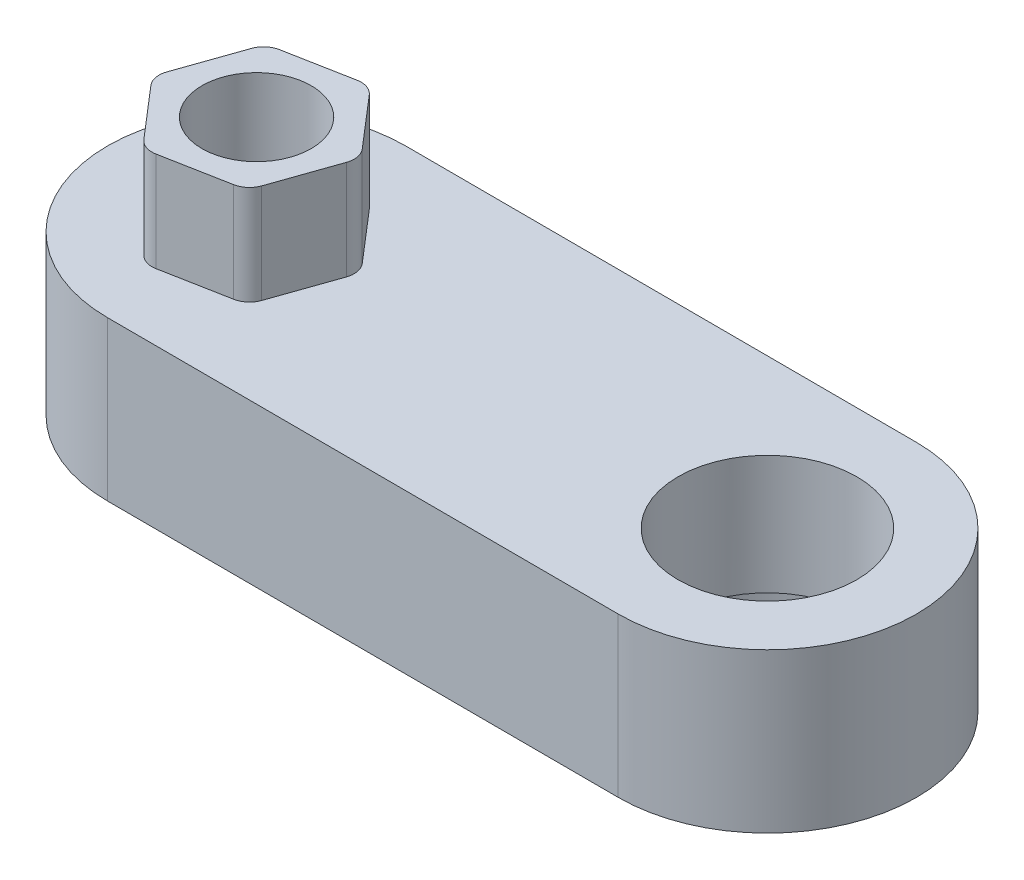
from build123d import *

# Parameters (mm, degrees)
BOSS_EXTRUDE1_DEPTH = 8
BOSS_EXTRUDE2_DEPTH = 5
SKETCH3_R           = 2.75
CUT_EXTRUDE1_DEPTH  = 47.101580863
FILLET1_R           = 1
CUT_EXTRUDE2_DEPTH  = 3
SKETCH5_R           = 6.6
CUT_EXTRUDE3_DEPTH  = 2
SKETCH6_R           = 4.5
CUT_EXTRUDE4_DEPTH  = 46.578018365


with BuildPart() as part:
    # Sketch1 → Boss-Extrude1 (new body)
    with BuildSketch(Plane(origin=(0, 0, 0), x_dir=(1, 0, 0), z_dir=(0, 1, 0))):
        with BuildLine():
            Line((28.167708625, -26.130388935), (2.369745396, -26.064259321))
            ThreePointArc((2.369745396, -26.064259321), (-5.111004784, -18.545058782), (2.408195755, -11.064308602))
            Line((2.408195755, -11.064308602), (28.206158985, -11.130438216))
            ThreePointArc((28.206158985, -11.130438216), (35.686909165, -18.649638756), (28.167708625, -26.130388935))
        make_face()
    extrude(amount=BOSS_EXTRUDE1_DEPTH)

    # Sketch2 → Boss-Extrude2 (add)
    with BuildSketch(Plane(origin=(0, 8, 0), x_dir=(1, 0, 0), z_dir=(0, 1, 0))):
        Polygon((0.900323586, -22.81445221), (5.325400754, -21.978574196), (6.814047744, -17.728405947), (3.877617565, -14.314115713), (-0.547459604, -15.149993727), (-2.036106593, -19.400161976), align=None)
    extrude(amount=BOSS_EXTRUDE2_DEPTH)

    # Sketch3 → Cut-Extrude1 (cut, through all)
    with BuildSketch(Plane(origin=(0, 13, 0), x_dir=(1, 0, 0), z_dir=(0, 1, 0))):
        with Locations((2.388970575, -18.564283961)):
            Circle(SKETCH3_R)
    extrude(amount=-CUT_EXTRUDE1_DEPTH, mode=Mode.SUBTRACT)

    # Fillet1
    fillet1_edges = [part.edges().sort_by_distance(p)[0] for p in [
        (-0.547459604, 10.5, 15.149993727),
        (3.877617565, 10.5, 14.314115713),
        (6.814047744, 10.5, 17.728405947),
        (-2.036106593, 10.5, 19.400161976),
        (0.900323586, 10.5, 22.81445221),
        (5.325400754, 10.5, 21.978574196),
    ]]
    fillet(fillet1_edges, radius=FILLET1_R)

    # Sketch4 → Cut-Extrude2 (cut)
    with BuildSketch(Plane.XZ):
        with BuildLine():
            Line((7.095087062, 18.438582147), (5.988144429, 21.598963665))
            ThreePointArc((5.988144429, 21.598963665), (5.550555759, 22.240369807), (4.850889783, 22.577049485))
            Line((4.850889783, 22.577049485), (1.560447786, 23.198599803))
            ThreePointArc((1.560447786, 23.198599803), (0.786179438, 23.140339969), (0.144773296, 22.702751299))
            Line((0.144773296, 22.702751299), (-2.038726067, 20.163920099))
            ThreePointArc((-2.038726067, 20.163920099), (-2.375405745, 19.464254124), (-2.317145911, 18.689985776))
            Line((-2.317145911, 18.689985776), (-1.210203278, 15.529604258))
            ThreePointArc((-1.210203278, 15.529604258), (-0.772614608, 14.888198116), (-0.072948633, 14.551518438))
            Line((-0.072948633, 14.551518438), (3.217493364, 13.92996812))
            ThreePointArc((3.217493364, 13.92996812), (3.991761712, 13.988227953), (4.633167854, 14.425816624))
            Line((4.633167854, 14.425816624), (6.816667218, 16.964647824))
            ThreePointArc((6.816667218, 16.964647824), (7.153346896, 17.664313799), (7.095087062, 18.438582147))
        make_face()
    extrude(amount=-CUT_EXTRUDE2_DEPTH, mode=Mode.SUBTRACT)

    # Sketch5 → Cut-Extrude3 (cut)
    with BuildSketch(Plane.XZ):
        with Locations((28.186933805, 18.630413576)):
            Circle(SKETCH5_R)
    extrude(amount=-CUT_EXTRUDE3_DEPTH, mode=Mode.SUBTRACT)

    # Sketch6 → Cut-Extrude4 (cut, through all)
    with BuildSketch(Plane.XZ.offset(-2)):
        with Locations((28.186933805, 18.630413576)):
            Circle(SKETCH6_R)
    extrude(amount=-CUT_EXTRUDE4_DEPTH, mode=Mode.SUBTRACT)


solid = part.part
